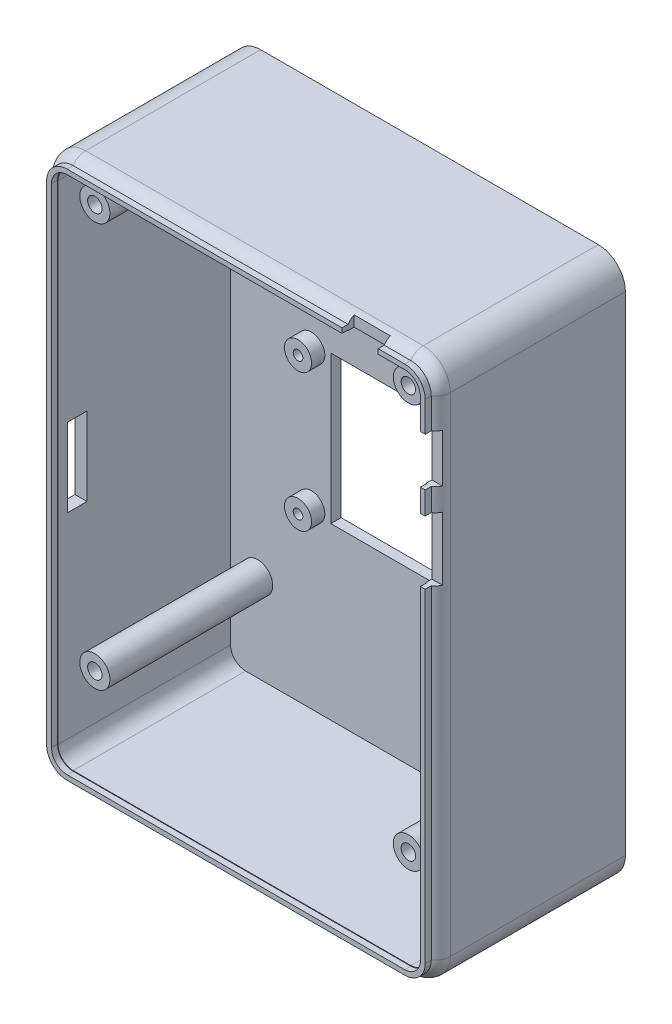
from build123d import *

# Parameters (mm, degrees)
FLOOR_2_DEPTH                     = 2.5
WALL_OUTER_HALF_DEPTH             = 31.1
WALL_INNER_HALF_DEPTH             = 31.1
LIP_DEPTH                         = 32.1
SCREEN_FACE_ROUND_OVER_R          = 2.5
SKETCH_5_R                        = 2.5
STANDOFFS_DEPTH                   = 29.5
SKETCH_6_R                        = 1.2
SCREW_BORES_DEPTH                 = 113.218135789
SKETCH_7_R                        = 2.1
SCREW_HEAD_RECESSES_DEPTH         = 1.5
SKETCH_8_R                        = 2.25
DISPLAY_POSTS_DEPTH               = 4.7
DISPLAY_START                     = 4.7
SKETCH_9_R                        = 0.8
DISPLAY_POST_PILOT_HOLES_M2_DEPTH = 4
SKETCH_10_W                       = 28.5
SKETCH_10_H                       = 28.5
SCREEN_FRAME_RECESS_DEPTH         = 0.8
SKETCH_11_W                       = 24.5
SKETCH_11_H                       = 24.5
DISPLAY_WINDOW_DEPTH              = 113.218135789
SKETCH_12_R                       = 1
CHARGE_LED_HOLE_D2_DEPTH          = 113.218135789
SKETCH_13_W                       = 3.2
SKETCH_13_H                       = 13
MICROSD_SLOT_DEPTH                = 113.218135789
USB_C_START                       = 59
SKETCH_14_W                       = 2.5
SKETCH_14_H                       = 10.5
USB_C_LIP_NOTCH_DEPTH             = 4.5
SWITCH_START                      = 59
SKETCH_15_W                       = 2.5
SKETCH_15_H                       = 8
SWITCH_LIP_NOTCH_DEPTH            = 4.5
SKETCH_16_W                       = 6
SKETCH_16_H                       = 2.5
SHUTTER_LIP_NOTCH_DEPTH           = 113.218135789


with BuildPart() as part:
    # 草圖1 → floor 2 (new body)
    with BuildSketch(Plane.XY):
        with BuildLine():
            Line((2, -87.5), (58, -87.5))
            ThreePointArc((58, -87.5), (61.181980515, -86.181980515), (62.5, -83))
            Line((62.5, -83), (62.5, -2))
            ThreePointArc((62.5, -2), (61.181980515, 1.181980515), (58, 2.5))
            Line((58, 2.5), (2, 2.5))
            ThreePointArc((2, 2.5), (-1.181980515, 1.181980515), (-2.5, -2))
            Line((-2.5, -2), (-2.5, -83))
            ThreePointArc((-2.5, -83), (-1.181980515, -86.181980515), (2, -87.5))
        make_face()
    extrude(amount=FLOOR_2_DEPTH)

    # 草圖2 → wall outer half (add)
    with BuildSketch(Plane.XY):
        with BuildLine():
            Line((2, -87.5), (58, -87.5))
            ThreePointArc((58, -87.5), (61.181980515, -86.181980515), (62.5, -83))
            Line((62.5, -83), (62.5, -2))
            ThreePointArc((62.5, -2), (61.181980515, 1.181980515), (58, 2.5))
            Line((58, 2.5), (2, 2.5))
            ThreePointArc((2, 2.5), (-1.181980515, 1.181980515), (-2.5, -2))
            Line((-2.5, -2), (-2.5, -83))
            ThreePointArc((-2.5, -83), (-1.181980515, -86.181980515), (2, -87.5))
        make_face()
        with BuildLine():
            Line((2, -86.5), (58, -86.5))
            ThreePointArc((58, -86.5), (60.474873734, -85.474873734), (61.5, -83))
            Line((61.5, -83), (61.5, -2))
            ThreePointArc((61.5, -2), (60.474873734, 0.474873734), (58, 1.5))
            Line((58, 1.5), (2, 1.5))
            ThreePointArc((2, 1.5), (-0.474873734, 0.474873734), (-1.5, -2))
            Line((-1.5, -2), (-1.5, -83))
            ThreePointArc((-1.5, -83), (-0.474873734, -85.474873734), (2, -86.5))
        make_face(mode=Mode.SUBTRACT)
    extrude(amount=WALL_OUTER_HALF_DEPTH)

    # 草圖3 → wall inner half (add)
    with BuildSketch(Plane.XY):
        with BuildLine():
            Line((2, -86.5), (58, -86.5))
            ThreePointArc((58, -86.5), (60.474873734, -85.474873734), (61.5, -83))
            Line((61.5, -83), (61.5, -2))
            ThreePointArc((61.5, -2), (60.474873734, 0.474873734), (58, 1.5))
            Line((58, 1.5), (2, 1.5))
            ThreePointArc((2, 1.5), (-0.474873734, 0.474873734), (-1.5, -2))
            Line((-1.5, -2), (-1.5, -83))
            ThreePointArc((-1.5, -83), (-0.474873734, -85.474873734), (2, -86.5))
        make_face()
        with BuildLine():
            Line((2, -85.5), (58, -85.5))
            ThreePointArc((58, -85.5), (59.767766953, -84.767766953), (60.5, -83))
            Line((60.5, -83), (60.5, -2))
            ThreePointArc((60.5, -2), (59.767766953, -0.232233047), (58, 0.5))
            Line((58, 0.5), (2, 0.5))
            ThreePointArc((2, 0.5), (0.232233047, -0.232233047), (-0.5, -2))
            Line((-0.5, -2), (-0.5, -83))
            ThreePointArc((-0.5, -83), (0.232233047, -84.767766953), (2, -85.5))
        make_face(mode=Mode.SUBTRACT)
    extrude(amount=WALL_INNER_HALF_DEPTH)

    # 草圖4 → lip (add)
    with BuildSketch(Plane.XY):
        with BuildLine():
            Line((2, -86.4), (58, -86.4))
            ThreePointArc((58, -86.4), (60.404163056, -85.404163056), (61.4, -83))
            Line((61.4, -83), (61.4, -2))
            ThreePointArc((61.4, -2), (60.404163056, 0.404163056), (58, 1.4))
            Line((58, 1.4), (2, 1.4))
            ThreePointArc((2, 1.4), (-0.404163056, 0.404163056), (-1.4, -2))
            Line((-1.4, -2), (-1.4, -83))
            ThreePointArc((-1.4, -83), (-0.404163056, -85.404163056), (2, -86.4))
        make_face()
        with BuildLine():
            Line((2, -85.6), (58, -85.6))
            ThreePointArc((58, -85.6), (59.838477631, -84.838477631), (60.6, -83))
            Line((60.6, -83), (60.6, -2))
            ThreePointArc((60.6, -2), (59.838477631, -0.161522369), (58, 0.6))
            Line((58, 0.6), (2, 0.6))
            ThreePointArc((2, 0.6), (0.161522369, -0.161522369), (-0.6, -2))
            Line((-0.6, -2), (-0.6, -83))
            ThreePointArc((-0.6, -83), (0.161522369, -84.838477631), (2, -85.6))
        make_face(mode=Mode.SUBTRACT)
    extrude(amount=LIP_DEPTH)

    # screen face round-over
    # the kernel refuses this fillet: 2.5 mm, written as the material it takes off along each edge
    with BuildSketch(Plane(origin=(2, -83, 31.1), x_dir=(-1, 0, 0), z_dir=(0, 1, 0))) as screen_face_round_over_piece_1:
        with BuildLine():
            CenterArc((2, -2.071231518), SCREEN_FACE_ROUND_OVER_R, 0, 55.944202257)
            Line((3.4, 0), (3.428, 0.04142463))
            ThreePointArc((3.428, 0.04142463), (3.95, 0.05), (4.5, 0.05))
            Line((4.5, 0.05), (4.55, 0))
            Line((4.55, 0), (4.55, -2.071231518))
            Line((4.55, -2.071231518), (4.5, -2.071231518))
        make_face()
    revolve(axis=Axis((2, -83, 31.1), (0, 0, 1)), revolution_arc=90, mode=Mode.SUBTRACT)
    with BuildSketch(Plane(origin=(2, -87.5, 31.1), x_dir=(0, 1.0, -2.745278751795259e-12), z_dir=(1, 0, 0)), Plane(origin=(58, 2.5, 31.1), x_dir=(0, -1.0, -2.7452787517952908e-12), z_dir=(-1, 0, 0))) as screen_face_round_over_piece_2:
        with BuildLine():
            CenterArc((2.5, -2.071231518), SCREEN_FACE_ROUND_OVER_R, 124.055797743, 55.944202257)
            Line((0, -2.071231518), (-0.05, -2.071231518))
            Line((-0.05, -2.071231518), (-0.05, 0))
            Line((-0.05, 0), (0, 0.05))
            ThreePointArc((0, 0.05), (0.55, 0.05), (1.072, 0.04142463))
            Line((1.072, 0.04142463), (1.1, 0))
        make_face()
    extrude(amount=56, mode=Mode.SUBTRACT)
    with BuildSketch(Plane(origin=(58, -83, 31.1), x_dir=(0, -1, 0), z_dir=(-1, 0, 0))) as screen_face_round_over_piece_3:
        with BuildLine():
            CenterArc((2, -2.071231518), SCREEN_FACE_ROUND_OVER_R, 0, 55.944202257)
            Line((4.5, -2.071231518), (4.55, -2.071231518))
            Line((4.55, -2.071231518), (4.55, 0))
            Line((4.55, 0), (4.5, 0.05))
            ThreePointArc((4.5, 0.05), (3.95, 0.05), (3.428, 0.04142463))
            Line((3.428, 0.04142463), (3.4, 0))
        make_face()
    revolve(axis=Axis((58, -83, 31.1), (0, 0, 1)), revolution_arc=90, mode=Mode.SUBTRACT)
    with BuildSketch(Plane(origin=(62.5, -83, 31.1), x_dir=(-1.0, 0, -2.7452787517953118e-12), z_dir=(0, 1, 0))) as screen_face_round_over_piece_4:
        with BuildLine():
            CenterArc((2.5, -2.071231518), SCREEN_FACE_ROUND_OVER_R, 124.055797743, 55.944202257)
            Line((0, -2.071231518), (-0.05, -2.071231518))
            Line((-0.05, -2.071231518), (-0.05, 0))
            Line((-0.05, 0), (0, 0.05))
            ThreePointArc((0, 0.05), (0.55, 0.05), (1.072, 0.04142463))
            Line((1.072, 0.04142463), (1.1, 0))
        make_face()
    extrude(amount=81, mode=Mode.SUBTRACT)
    with BuildSketch(Plane(origin=(58, -2, 31.1), x_dir=(1, 0, 0), z_dir=(0, -1, 0))) as screen_face_round_over_piece_5:
        with BuildLine():
            CenterArc((2, -2.071231518), SCREEN_FACE_ROUND_OVER_R, 0, 55.944202257)
            Line((4.5, -2.071231518), (4.55, -2.071231518))
            Line((4.55, -2.071231518), (4.55, 0))
            Line((4.55, 0), (4.5, 0.05))
            ThreePointArc((4.5, 0.05), (3.95, 0.05), (3.428, 0.04142463))
            Line((3.428, 0.04142463), (3.4, 0))
        make_face()
    revolve(axis=Axis((58, -2, 31.1), (0, 0, 1)), revolution_arc=90, mode=Mode.SUBTRACT)
    with BuildSketch(Plane(origin=(2, -2, 31.1), x_dir=(0, 1, 0), z_dir=(1, 0, 0))) as screen_face_round_over_piece_6:
        with BuildLine():
            CenterArc((2, -2.071231518), SCREEN_FACE_ROUND_OVER_R, 0, 55.944202257)
            Line((4.5, -2.071231518), (4.55, -2.071231518))
            Line((4.55, -2.071231518), (4.55, 0))
            Line((4.55, 0), (4.5, 0.05))
            ThreePointArc((4.5, 0.05), (3.95, 0.05), (3.428, 0.04142463))
            Line((3.428, 0.04142463), (3.4, 0))
        make_face()
    revolve(axis=Axis((2, -2, 31.1), (0, 0, 1)), revolution_arc=90, mode=Mode.SUBTRACT)
    with BuildSketch(Plane(origin=(-2.5, -2, 31.1), x_dir=(0, 0, -1), z_dir=(0, -1, 0))) as screen_face_round_over_piece_7:
        with BuildLine():
            CenterArc((2.071231518, 2.5), SCREEN_FACE_ROUND_OVER_R, 214.055797743, 55.944202257)
            Line((0, 1.1), (-0.04142463, 1.072))
            ThreePointArc((-0.04142463, 1.072), (-0.05, 0.55), (-0.05, 0))
            Line((-0.05, 0), (0, -0.05))
            Line((0, -0.05), (2.071231518, -0.05))
            Line((2.071231518, -0.05), (2.071231518, 0))
        make_face()
    extrude(amount=81, mode=Mode.SUBTRACT)

    # 草圖5 → standoffs (add)
    with BuildSketch(Plane.XY):
        with Locations(Location((4, -4, 0), (0, 0, 180))):
            Circle(SKETCH_5_R)
        with Locations(Location((56, -4, 0), (0, 0, 180))):
            Circle(SKETCH_5_R)
        with Locations(Location((4, -71, 0), (0, 0, 180))):
            Circle(SKETCH_5_R)
        with Locations(Location((56, -71, 0), (0, 0, 180))):
            Circle(SKETCH_5_R)
    extrude(amount=STANDOFFS_DEPTH)

    # 草圖6 → screw bores (cut, through all)
    with BuildSketch(Plane.XY):
        with Locations((4, -4)):
            Circle(SKETCH_6_R)
        with Locations((56, -4)):
            Circle(SKETCH_6_R)
        with Locations((4, -71)):
            Circle(SKETCH_6_R)
        with Locations((56, -71)):
            Circle(SKETCH_6_R)
    extrude(amount=SCREW_BORES_DEPTH, mode=Mode.SUBTRACT)

    # 草圖7 → screw head recesses (cut)
    with BuildSketch(Plane.XY):
        with Locations((4, -4)):
            Circle(SKETCH_7_R)
        with Locations((56, -4)):
            Circle(SKETCH_7_R)
        with Locations((4, -71)):
            Circle(SKETCH_7_R)
        with Locations((56, -71)):
            Circle(SKETCH_7_R)
    extrude(amount=SCREW_HEAD_RECESSES_DEPTH, mode=Mode.SUBTRACT)

    # 草圖8 → display posts (add)
    with BuildSketch(Plane.XY):
        with Locations((12.9, -33.6)):
            Circle(SKETCH_8_R)
        with Locations((12.9, -56.4)):
            Circle(SKETCH_8_R)
        with Locations((47.1, -33.6)):
            Circle(SKETCH_8_R)
        with Locations((47.1, -56.4)):
            Circle(SKETCH_8_R)
    extrude(amount=DISPLAY_POSTS_DEPTH)

    # 草圖9 → display post pilot holes M2 (cut)
    with BuildSketch(Plane.XY.offset(DISPLAY_START)):
        with Locations((12.9, -33.6)):
            Circle(SKETCH_9_R)
        with Locations((12.9, -56.4)):
            Circle(SKETCH_9_R)
        with Locations((47.1, -33.6)):
            Circle(SKETCH_9_R)
        with Locations((47.1, -56.4)):
            Circle(SKETCH_9_R)
    extrude(amount=-DISPLAY_POST_PILOT_HOLES_M2_DEPTH, mode=Mode.SUBTRACT)

    # 草圖10 → screen frame recess (cut)
    with BuildSketch(Plane.XY):
        with Locations((28.4, -45)):
            Rectangle(SKETCH_10_W, SKETCH_10_H)
    extrude(amount=SCREEN_FRAME_RECESS_DEPTH, mode=Mode.SUBTRACT)

    # 草圖11 → display window (cut, through all)
    with BuildSketch(Plane.XY):
        with Locations((28.4, -45)):
            Rectangle(SKETCH_11_W, SKETCH_11_H)
    extrude(amount=DISPLAY_WINDOW_DEPTH, mode=Mode.SUBTRACT)

    # 草圖12 → charge LED hole D2 (cut, through all)
    with BuildSketch(Plane.XY):
        with Locations((53, -14)):
            Circle(SKETCH_12_R)
    extrude(amount=CHARGE_LED_HOLE_D2_DEPTH, mode=Mode.SUBTRACT)

    # 草圖13 → microSD slot (cut, through all)
    with BuildSketch(Plane(origin=(0, 0, 0), x_dir=(0, 0, -1), z_dir=(1, 0, 0))):
        with Locations((-27.9, -44)):
            Rectangle(SKETCH_13_W, SKETCH_13_H)
    extrude(amount=-MICROSD_SLOT_DEPTH, mode=Mode.SUBTRACT)

    # 草圖14 → USB-C lip notch (cut)
    with BuildSketch(Plane(origin=(0, 0, 0), x_dir=(0, 0, -1), z_dir=(1, 0, 0)).offset(USB_C_START)):
        with Locations((-31.35, -24)):
            Rectangle(SKETCH_14_W, SKETCH_14_H)
    extrude(amount=USB_C_LIP_NOTCH_DEPTH, mode=Mode.SUBTRACT)

    # 草圖15 → switch lip notch (cut)
    with BuildSketch(Plane(origin=(0, 0, 0), x_dir=(0, 0, -1), z_dir=(1, 0, 0)).offset(SWITCH_START)):
        with Locations((-31.35, -11)):
            Rectangle(SKETCH_15_W, SKETCH_15_H)
    extrude(amount=SWITCH_LIP_NOTCH_DEPTH, mode=Mode.SUBTRACT)

    # 草圖16 → shutter lip notch (cut, through all)
    with BuildSketch(Plane(origin=(0, 0, 0), x_dir=(1, 0, 0), z_dir=(0, 1, 0))):
        with Locations((50.6, -31.35)):
            Rectangle(SKETCH_16_W, SKETCH_16_H)
    extrude(amount=SHUTTER_LIP_NOTCH_DEPTH, mode=Mode.SUBTRACT)


solid = part.part
